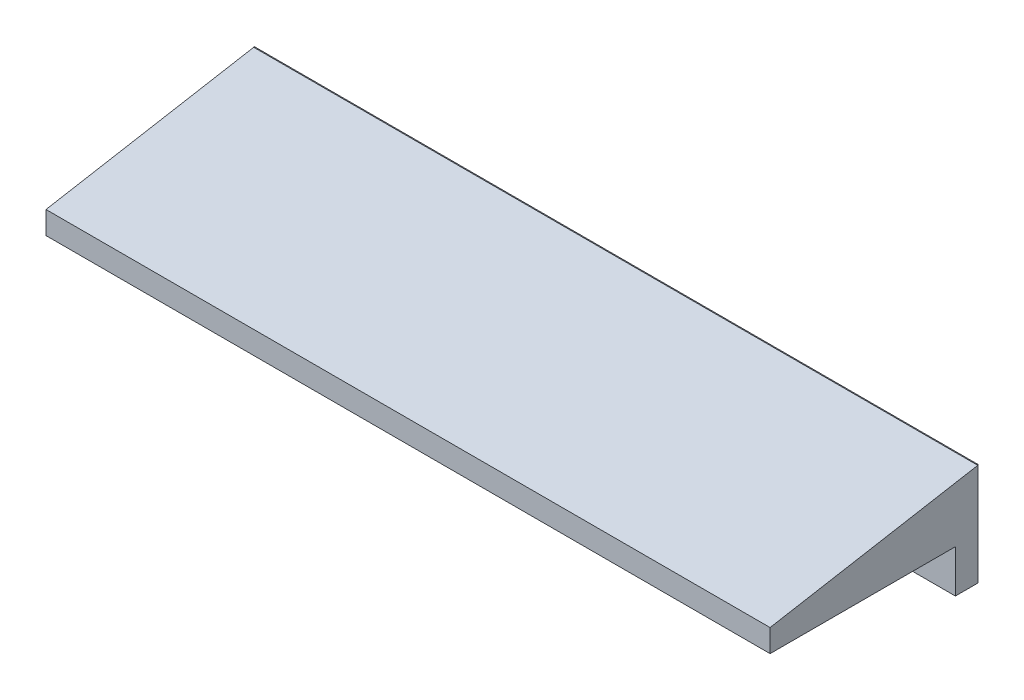
from build123d import *

# Parameters (mm, degrees)
SKETCH1_W           = 101.6
SKETCH1_H           = 26
BOSS_EXTRUDE1_DEPTH = 3.175
SKETCH2_W           = 101.6
SKETCH2_H           = 9.175
BOSS_EXTRUDE2_DEPTH = 3.175
SKETCH3_R           = 1.6
CUT_EXTRUDE1_DEPTH  = 3.175
BOSS_EXTRUDE3_DEPTH = 101.6


with BuildPart() as part:
    # Sketch1 → Boss-Extrude1 (new body)
    with BuildSketch(Plane(origin=(0, 0, 0), x_dir=(1, 0, 0), z_dir=(0, 1, 0))):
        Rectangle(SKETCH1_W, SKETCH1_H)
    extrude(amount=BOSS_EXTRUDE1_DEPTH)

    # Sketch2 → Boss-Extrude2 (add)
    with BuildSketch(Plane(origin=(0, 0, -13), x_dir=(-1, 0, 0), z_dir=(0, 0, -1))):
        with Locations((0, -1.4125)):
            Rectangle(SKETCH2_W, SKETCH2_H)
    extrude(amount=BOSS_EXTRUDE2_DEPTH)

    # Sketch3 → Cut-Extrude1 (cut)
    with BuildSketch(Plane.XY.offset(-13)):
        with Locations((30.3075, -3)):
            Circle(SKETCH3_R)
        with Locations((-30.3075, -3)):
            Circle(SKETCH3_R)
        with Locations((43.9685, -3)):
            Circle(SKETCH3_R)
        with Locations((-43.9685, -3)):
            Circle(SKETCH3_R)
    extrude(amount=-CUT_EXTRUDE1_DEPTH, mode=Mode.SUBTRACT)

    # Sketch4 → Boss-Extrude3 (add)
    with BuildSketch(Plane(origin=(50.8, 0, 0), x_dir=(0, 0, -1), z_dir=(1, 0, 0))):
        Polygon((16.143192443, 8.313731132), (-13, 3.175), (16.175, 3.175), (16.175, 8.412812241), align=None)
    extrude(amount=-BOSS_EXTRUDE3_DEPTH)


solid = part.part
